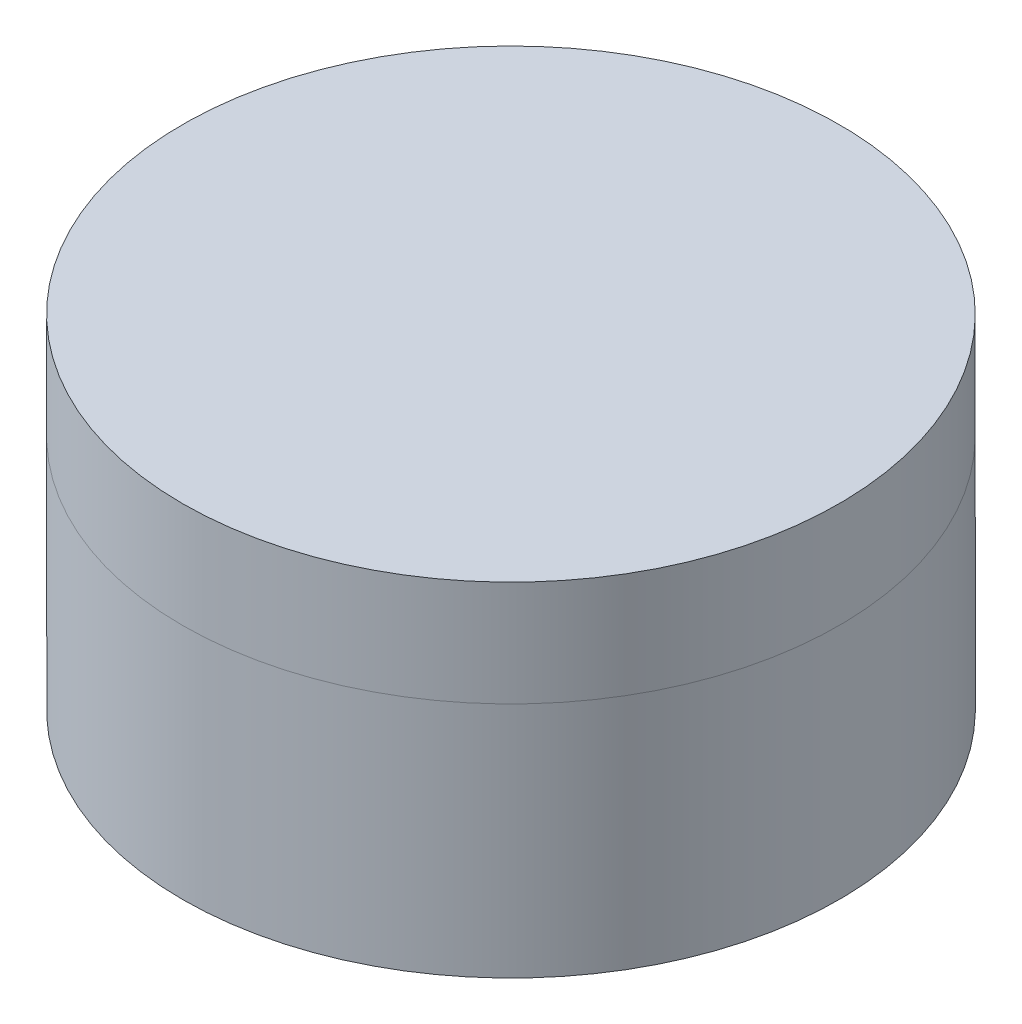
from build123d import *

# Parameters (mm, degrees)
BOSS_EXTRUDE2_DEPTH      = 2
BOSS_EXTRUDE2_DEPTH_BACK = 7
SKETCH2_R                = 12.45
SKETCH3_R                = 1.475
CUT_EXTRUDE1_DEPTH       = 6.05
SKETCH4_R                = 7
CUT_EXTRUDE2_DEPTH       = 4.05
SKETCH5_R                = 12.45
BOSS_EXTRUDE3_DEPTH      = 4


with BuildPart() as part:
    # Sketch2 → Boss-Extrude2 (new, two sides: drawn at the far end of the back side and taken through both)
    with BuildSketch(Plane(origin=(0, 14, 0), x_dir=(1, 0, 0), z_dir=(0, 1, 0)).offset(-BOSS_EXTRUDE2_DEPTH_BACK)):
        with Locations((-0.498, 0)):
            Circle(SKETCH2_R)
    extrude(amount=BOSS_EXTRUDE2_DEPTH + BOSS_EXTRUDE2_DEPTH_BACK)

    # Sketch3 → Cut-Extrude1 (cut)
    with BuildSketch(Plane.XZ.offset(-7)):
        with Locations((9.5, 0)):
            Circle(SKETCH3_R)
        with Locations((4.5, -8.660254038)):
            Circle(SKETCH3_R)
        with Locations((-5.5, -8.660254038)):
            Circle(SKETCH3_R)
        with Locations((-10.5, 0)):
            Circle(SKETCH3_R)
        with Locations((-5.5, 8.660254038)):
            Circle(SKETCH3_R)
        with Locations((4.5, 8.660254038)):
            Circle(SKETCH3_R)
    extrude(amount=-CUT_EXTRUDE1_DEPTH, mode=Mode.SUBTRACT)

    # Sketch4 → Cut-Extrude2 (cut)
    with BuildSketch(Plane.XZ.offset(-7)):
        with Locations((-0.5, 0)):
            Circle(SKETCH4_R)
    extrude(amount=-CUT_EXTRUDE2_DEPTH, mode=Mode.SUBTRACT)

    # Sketch5 → Boss-Extrude3 (add)
    with BuildSketch(Plane(origin=(0, 16, 0), x_dir=(1, 0, 0), z_dir=(0, 1, 0))):
        with Locations((-0.5, 0)):
            Circle(SKETCH5_R)
    extrude(amount=BOSS_EXTRUDE3_DEPTH)


solid = part.part
